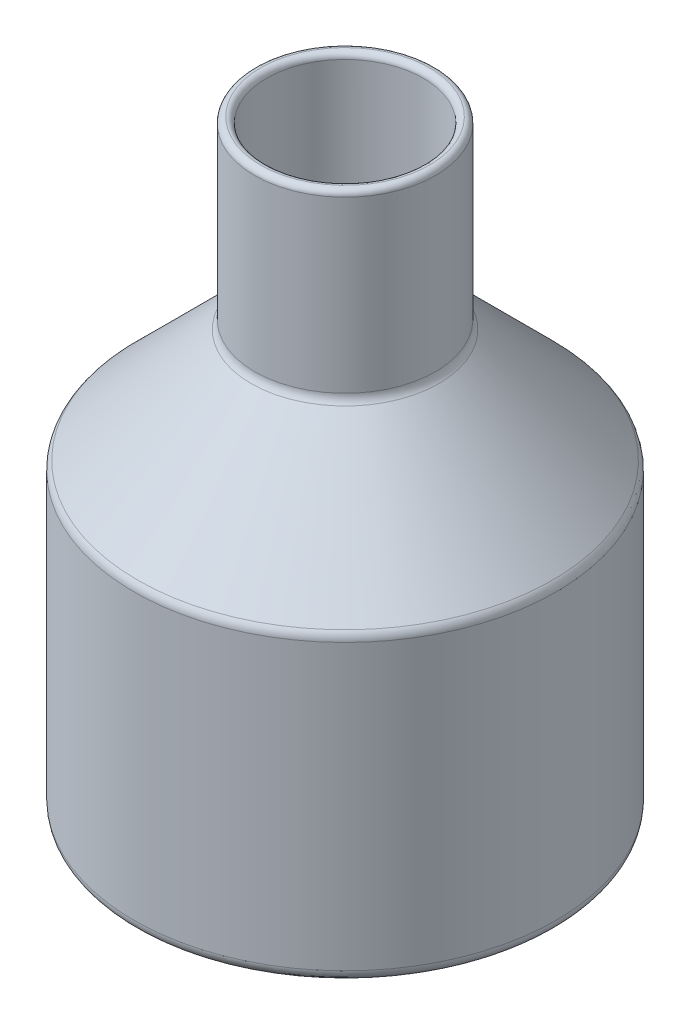
from build123d import *

# Parameters (mm, degrees)
FILLET_3_R = 2
FILLET_4_R = 1
FILLET_5_R = 2


with BuildPart() as part:
    # 스케치1 → 회전1 (revolve)
    with BuildSketch(Plane.XY, mode=Mode.PRIVATE) as revolve_1_sk:
        Polygon((-11.86312796, -69.973918824), (-46.86312796, -69.973918824), (-46.86312796, -19.973918824), (-26.86312796, 0.026081176), (-26.86312796, 30.026081176), (-24.86312796, 30.026081176), (-24.86312796, 28.026081176), (-24.86312796, -0.802345949), (-44.86312796, -20.802345949), (-44.86312796, -67.973918824), (-11.86312796, -67.973918824), align=None)
    revolve(revolve_1_sk.sketch.rotate(Axis((-11.86312796, 50.325613141, 0), (0, -1, 0)), 270), axis=Axis((-11.86312796, 50.325613141, 0), (0, -1, 0)))

    # 필렛3
    fillet_3_edges = [part.edges().sort_by_distance(p)[0] for p in [
        (-11.86312796, 0.026081176, -15),
        (-11.86312796, -19.973918824, -35),
        (-11.86312796, -67.973918824, -33),
        (-11.86312796, -20.802345949, -33),
        (-11.86312796, -0.802345949, -13),
    ]]
    fillet(fillet_3_edges, radius=FILLET_3_R)

    # 필렛4
    fillet_4_edges = [part.edges().sort_by_distance(p)[0] for p in [
        (-11.86312796, 30.026081176, -15),
        (-11.86312796, 30.026081176, -13),
    ]]
    fillet(fillet_4_edges, radius=FILLET_4_R - 0.0001)  # a hair under: the kernel refuses the full size

    # 필렛5
    fillet_5_edges = [part.edges().sort_by_distance(p)[0] for p in [
        (-11.86312796, -69.973918824, -35),
    ]]
    fillet(fillet_5_edges, radius=FILLET_5_R)


solid = part.part
